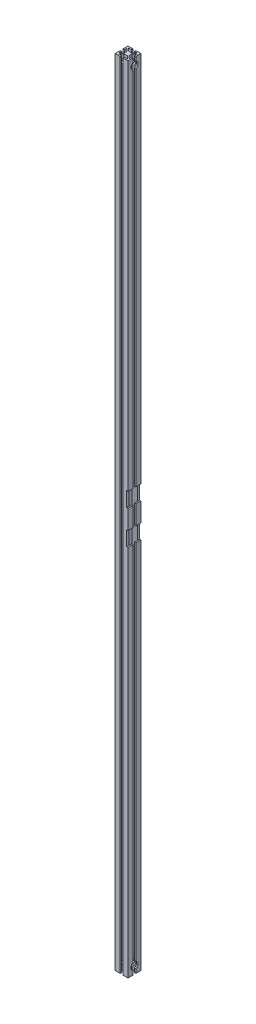
from build123d import *

# Parameters (mm, degrees)
EXTRUDE1_DEPTH          = 2349.5
SKETCH2_W               = 127
SKETCH2_H               = 43.18
EXTRUDE2_DEPTH          = 4.064
SKETCH3_R               = 10.3124
CUT_EXTRUDE1_DEPTH      = 16.51
MIRROR2_COPY_1_SKETCH_R = 10.3124
MIRROR2_COPY_1_DEPTH    = 16.51


# Read off the part's stored shape, not the designer's step: 1515<1>
with BuildPart() as part:
    # Sketch1<2> → Extrude1 (new body)
    with BuildSketch(Plane(origin=(0, 0, 0), x_dir=(1, 0, 0), z_dir=(0, 1, 0))):
        Polygon((-6.7564, 4.364749804), (-6.7564, -4.364749804), (-14.986, -12.594349804), (-14.986, -4.064), (-19.05, -4.064), (-19.05, -19.05), (-4.064, -19.05), (-4.064, -14.986), (-13.067127258, -14.986), (-4.837527258, -6.7564), (4.837527258, -6.7564), (13.067127258, -14.986), (4.064, -14.986), (4.064, -19.05), (19.05, -19.05), (19.05, -4.064), (14.986, -4.064), (14.986, -12.594349804), (6.7564, -4.364749804), (6.7564, 4.364749804), (14.986, 12.594349804), (14.986, 4.064), (19.05, 4.064), (19.05, 19.05), (4.064, 19.05), (4.064, 14.986), (13.067127258, 14.986), (4.837527258, 6.7564), (-4.837527258, 6.7564), (-13.067127258, 14.986), (-4.064, 14.986), (-4.064, 19.05), (-19.05, 19.05), (-19.05, 4.064), (-14.986, 4.064), (-14.986, 12.594349804), align=None)
    extrude(amount=EXTRUDE1_DEPTH)

    # Sketch2 → Extrude2 (cut)
    with BuildSketch(Plane(origin=(19.05, 0, 0), x_dir=(0, 0, -1), z_dir=(1, 0, 0))):
        with Locations((0, 1224.915)):
            Rectangle(SKETCH2_W, SKETCH2_H)
        with Locations((0, 1124.585)):
            Rectangle(SKETCH2_W, SKETCH2_H)
    extrude(amount=-EXTRUDE2_DEPTH, mode=Mode.SUBTRACT)

    # Sketch3 → Cut-Extrude1 (cut)
    with BuildSketch(Plane.ZY.offset(19.05)):
        with Locations(Location((0, 21.717, 0), (0, 0, 310.932724574))):
            Circle(SKETCH3_R)
    cut_extrude1 = extrude(amount=-CUT_EXTRUDE1_DEPTH, mode=Mode.SUBTRACT)

    # Mirror1: Cut-Extrude1 across plane
    add(cut_extrude1.mirror(Plane(origin=(0, 0, 0), x_dir=(0, 0, 1), z_dir=(1, 0, 0))), mode=Mode.SUBTRACT)

    # Mirror2: Cut-Extrude1 across plane
    add(cut_extrude1.mirror(Plane(origin=(0, 1174.75, 0), x_dir=(0, 0, 1), z_dir=(0, -1, 0))), mode=Mode.SUBTRACT)

    # Mirror2 copy 1 sketch → Mirror2 copy 1 (cut)
    with BuildSketch(Plane(origin=(19.05, 2349.5, 0), x_dir=(0, 0, 1), z_dir=(1, 0, 0))):
        with Locations(Location((0, 21.717, 0), (0, 0, 310.932724574))):
            Circle(MIRROR2_COPY_1_SKETCH_R)
    extrude(amount=-MIRROR2_COPY_1_DEPTH, mode=Mode.SUBTRACT)


solid = part.part
